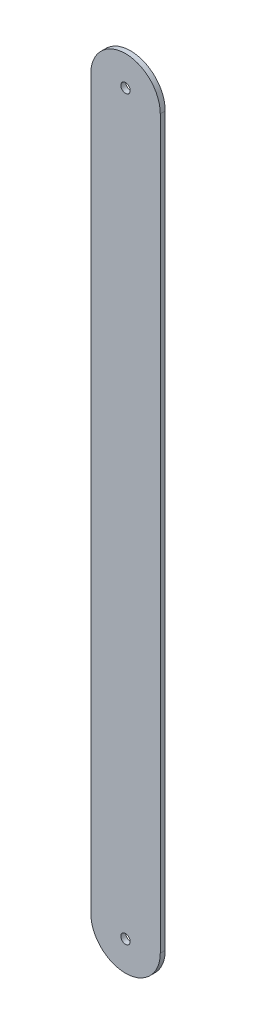
from build123d import *

# Parameters (mm, degrees)
SKETCH1_R           = 1.5
BOSS_EXTRUDE1_DEPTH = 1.5875


with BuildPart() as part:
    # Sketch1 → Boss-Extrude1 (new body)
    with BuildSketch(Plane.XY):
        with BuildLine():
            Line((11.1125, -116.2685), (11.1125, 116.2685))
            ThreePointArc((11.1125, 116.2685), (0, 127.381), (-11.1125, 116.2685))
            Line((-11.1125, 116.2685), (-11.1125, -116.2685))
            ThreePointArc((-11.1125, -116.2685), (0, -127.381), (11.1125, -116.2685))
        make_face()
        with Locations((0, 117.856)):
            Circle(SKETCH1_R, mode=Mode.SUBTRACT)
        with Locations((0, -117.856)):
            Circle(SKETCH1_R, mode=Mode.SUBTRACT)
    extrude(amount=BOSS_EXTRUDE1_DEPTH)


solid = part.part
